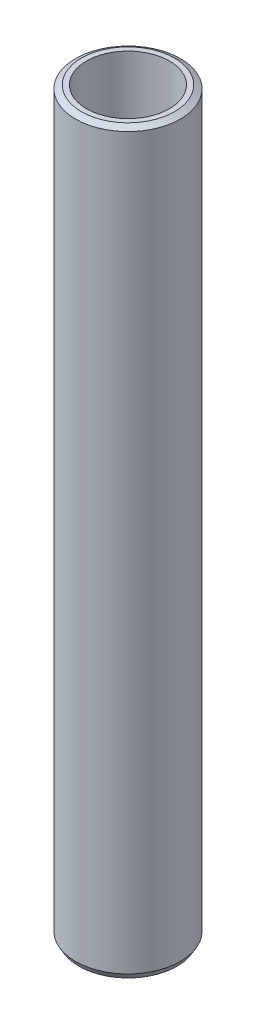
from build123d import *
from OCP.BRepFilletAPI import BRepFilletAPI_MakeChamfer

# Parameters (mm, degrees)
SKETCH1_R           = 35
BOSS_EXTRUDE1_DEPTH = 493.145552171
SKETCH2_R           = 27.649921817
CUT_EXTRUDE1_DEPTH  = 496.623380831
CHAMFER1_SIZE       = 2.283714505
CHAMFER1_SIZE2      = 3.955509552


with BuildPart() as part:
    # Sketch1 → Boss-Extrude1 (new body)
    with BuildSketch(Plane(origin=(0, 0, 0), x_dir=(1, 0, 0), z_dir=(0, 1, 0))):
        Circle(SKETCH1_R)
    extrude(amount=BOSS_EXTRUDE1_DEPTH)

    # Sketch2 → Cut-Extrude1 (cut, through all)
    with BuildSketch(Plane(origin=(0, 0, 0), x_dir=(1, 0, 0), z_dir=(0, 1, 0))):
        Circle(SKETCH2_R)
    extrude(amount=CUT_EXTRUDE1_DEPTH, mode=Mode.SUBTRACT)

    # Chamfer1: one chamfer whose edges measure the first distance from different faces: ONE call of the kernel's chamfer builder (chamfer() names one face for all edges)
    chamfer1_edges_1 = [part.edges().sort_by_distance(p)[0] for p in [
        (-35, 493.145552171, 0),
    ]]
    chamfer1_side_1 = [part.faces().sort_by_distance(p)[0] for p in [
        (-35, 246.572776086, 0),
    ]]
    chamfer1_edges_2 = [part.edges().sort_by_distance(p)[0] for p in [
        (-35, 0, 0),
    ]]
    chamfer1_side_2 = [part.faces().sort_by_distance(p)[0] for p in [
        (-34.010050506, 0, 0),
    ]]
    chamfer1 = BRepFilletAPI_MakeChamfer(part.part.solid().wrapped)
    for e in chamfer1_edges_1:
        chamfer1.Add(CHAMFER1_SIZE, CHAMFER1_SIZE2, e.wrapped, chamfer1_side_1[0].wrapped)  # the first distance lies on this face
    for e in chamfer1_edges_2:
        chamfer1.Add(CHAMFER1_SIZE, CHAMFER1_SIZE2, e.wrapped, chamfer1_side_2[0].wrapped)  # the first distance lies on this face
    add(Compound.cast(chamfer1.Shape()), mode=Mode.REPLACE)


solid = part.part
